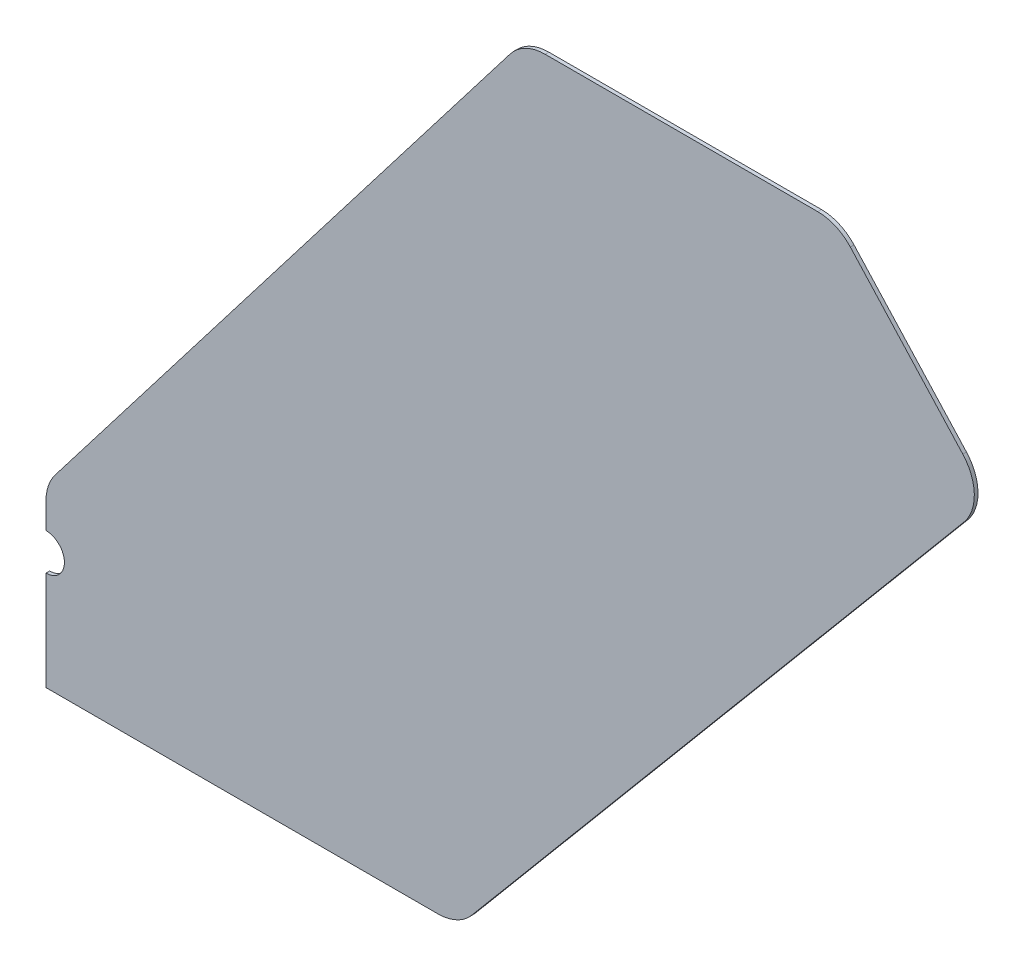
from build123d import *

# Parameters (mm, degrees)
BASE_FLANGE1_DEPTH = 2.5


# Sheet-metal steps are written as plain solids
with BuildPart() as part:
    # Sketch1 → Base-Flange1 (new body)
    with BuildSketch(Plane.XY):
        with BuildLine():
            Line((-134.197014838, 0), (131.813755418, 0))
            ThreePointArc((131.813755418, 0), (144.49230327, 2.810766389), (154.795088711, 10.716371709))
            Line((154.795088711, 10.716371709), (488.882789575, 408.866589455))
            ThreePointArc((488.882789575, 408.866589455), (495.894882012, 428.778240774), (488.055453139, 448.3789207))
            Line((488.055453139, 448.3789207), (411.771088084, 531.923752399))
            ThreePointArc((411.771088084, 531.923752399), (401.723678511, 539.143738745), (389.617091226, 541.695049445))
            Line((389.617091226, 541.695049445), (204.630312304, 541.695049445))
            ThreePointArc((204.630312304, 541.695049445), (191.371044435, 538.605861688), (180.842467764, 529.974503817))
            Line((180.842467764, 529.974503817), (-127.984859378, 128.084146569))
            ThreePointArc((-127.984859378, 128.084146569), (-132.601550886, 119.457791797), (-134.197014838, 109.804692197))
            Line((-134.197014838, 109.804692197), (-134.197014838, 92.304692197))
            ThreePointArc((-134.197014838, 92.304692197), (-121.697014838, 79.804692197), (-134.197014838, 67.304692197))
            Line((-134.197014838, 67.304692197), (-134.197014838, 0))
        make_face()
    extrude(amount=-BASE_FLANGE1_DEPTH)


solid = part.part
